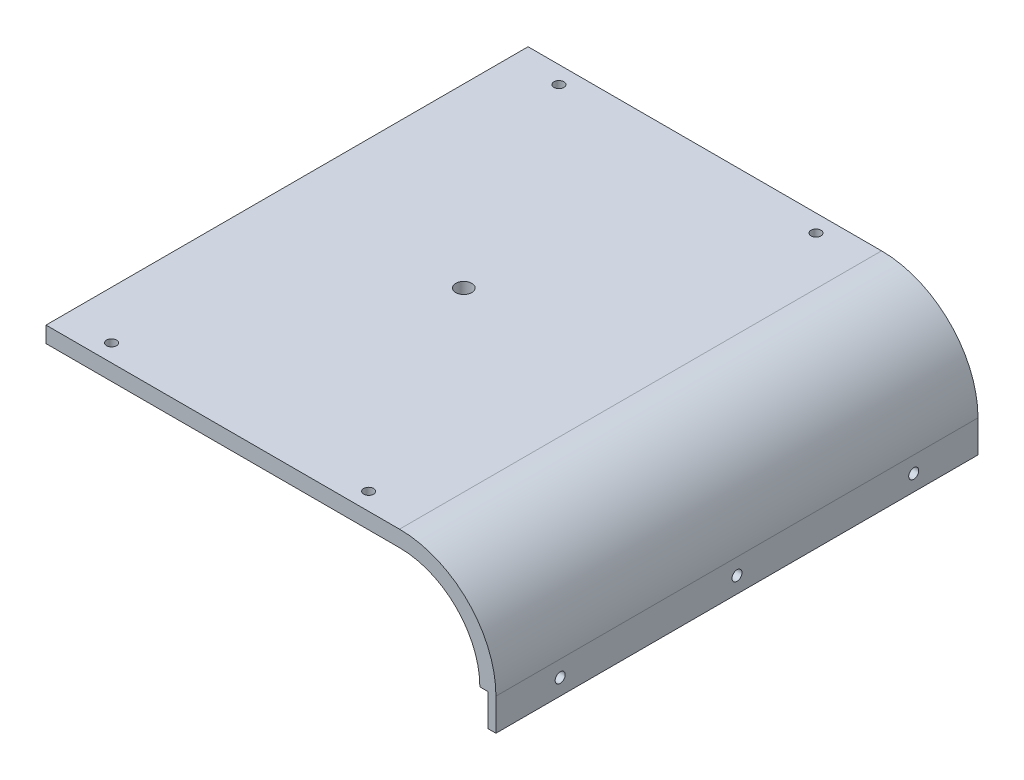
from build123d import *

# Parameters (mm, degrees)
BOSS_EXTRUDE1_DEPTH      = 190.5
BOSS_EXTRUDE1_DEPTH_BACK = 190.5
SKETCH2_W                = 6.35
SKETCH2_H                = 381
BOSS_EXTRUDE2_DEPTH      = 25.4
SKETCH3_R                = 3.96875
CUT_EXTRUDE1_DEPTH       = 25.4
SKETCH4_R                = 6.35
CUT_EXTRUDE2_DEPTH       = 17.78
SKETCH7_R                = 3.937
CUT_EXTRUDE3_DEPTH       = 306.328708116


with BuildPart() as part:
    # Sketch1 → Boss-Extrude1 (new, two sides: drawn at the far end of the back side and taken through both)
    with BuildSketch(Plane.XY.offset(-BOSS_EXTRUDE1_DEPTH_BACK)):
        with BuildLine():
            Line((-139.7, 0), (139.7, 0))
            ThreePointArc((139.7, 0), (193.581536726, -22.318463274), (215.9, -76.2))
            Line((215.9, -76.2), (203.2, -76.2))
            ThreePointArc((203.2, -76.2), (184.601280605, -31.298719395), (139.7, -12.7))
            Line((139.7, -12.7), (-139.7, -12.7))
            Line((-139.7, -12.7), (-139.7, 0))
        make_face()
    extrude(amount=BOSS_EXTRUDE1_DEPTH + BOSS_EXTRUDE1_DEPTH_BACK)

    # Sketch2 → Boss-Extrude2 (add)
    with BuildSketch(Plane.XZ.offset(76.2)):
        with Locations((212.725, 0)):
            Rectangle(SKETCH2_W, SKETCH2_H)
    extrude(amount=BOSS_EXTRUDE2_DEPTH)

    # Sketch3 → Cut-Extrude1 (cut)
    with BuildSketch(Plane(origin=(215.9, 0, 0), x_dir=(0, 0, -1), z_dir=(1, 0, 0))):
        with Locations((-139.7, -88.9)):
            Circle(SKETCH3_R)
        with Locations((0, -88.9)):
            Circle(SKETCH3_R)
        with Locations((139.7, -88.9)):
            Circle(SKETCH3_R)
    extrude(amount=-CUT_EXTRUDE1_DEPTH, mode=Mode.SUBTRACT)

    # Sketch4 → Cut-Extrude2 (cut)
    with BuildSketch(Plane(origin=(0, 0, 0), x_dir=(1, 0, 0), z_dir=(0, 1, 0))):
        Circle(SKETCH4_R)
    extrude(amount=-CUT_EXTRUDE2_DEPTH, mode=Mode.SUBTRACT)

    # Sketch7 → Cut-Extrude3 (cut, through all)
    with BuildSketch(Plane(origin=(0, 0, 0), x_dir=(1, 0, 0), z_dir=(0, 1, 0))):
        with Locations((101.6, 176.784)):
            Circle(SKETCH7_R)
        with Locations((-101.6, 176.784)):
            Circle(SKETCH7_R)
        with Locations((101.6, -176.784)):
            Circle(SKETCH7_R)
        with Locations((-101.6, -176.784)):
            Circle(SKETCH7_R)
    extrude(amount=-CUT_EXTRUDE3_DEPTH, mode=Mode.SUBTRACT)


solid = part.part
